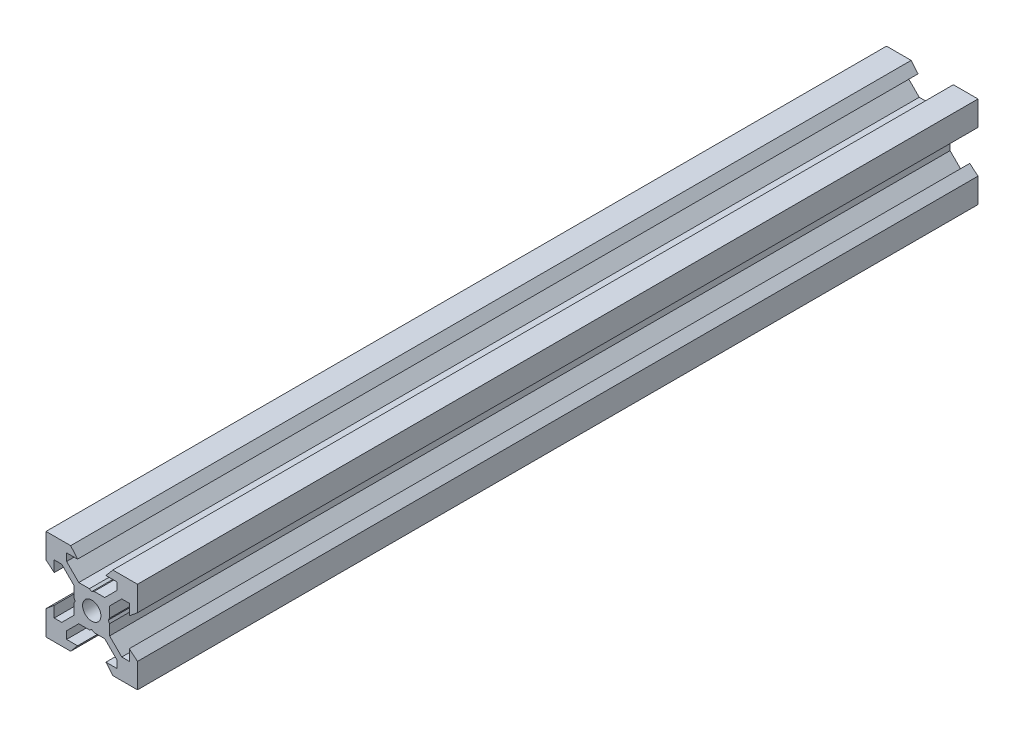
from build123d import *

# Parameters (mm, degrees)
SKETCH1_R           = 2
BOSS_EXTRUDE1_DEPTH = 91.87


with BuildPart() as part:
    # Sketch1 → Boss-Extrude1 (new, symmetric)
    with BuildSketch(Plane.XY):
        Polygon((10, 4.610379336), (10, 10), (4.610379336, 10), (3.1, 8.2), (5.5, 8.2), (5.5, 6.560660172), (2.839339828, 3.9), (0.519615242, 3.9), (0, 3.6), (-0.519615242, 3.9), (-2.839339828, 3.9), (-5.5, 6.560660172), (-5.5, 8.2), (-3.1, 8.2), (-4.610379336, 10), (-10, 10), (-10, 4.610379336), (-8.2, 3.1), (-8.2, 5.5), (-6.560660172, 5.5), (-3.9, 2.839339828), (-3.9, 0.519615242), (-3.6, 0), (-3.9, -0.519615242), (-3.9, -2.839339828), (-6.560660172, -5.5), (-8.2, -5.5), (-8.2, -3.1), (-10, -4.610379336), (-10, -10), (-4.610379336, -10), (-3.1, -8.2), (-5.5, -8.2), (-5.5, -6.560660172), (-2.839339828, -3.9), (-0.519615242, -3.9), (0, -3.6), (0.519615242, -3.9), (2.839339828, -3.9), (5.5, -6.560660172), (5.5, -8.2), (3.1, -8.2), (4.610379336, -10), (10, -10), (10, -4.610379336), (8.2, -3.1), (8.2, -5.5), (6.560660172, -5.5), (3.9, -2.839339828), (3.9, -0.519615242), (3.6, 0), (3.9, 0.519615242), (3.9, 2.839339828), (6.560660172, 5.5), (8.2, 5.5), (8.2, 3.1), align=None)
        Circle(SKETCH1_R, mode=Mode.SUBTRACT)
    extrude(amount=BOSS_EXTRUDE1_DEPTH, both=True)


solid = part.part
